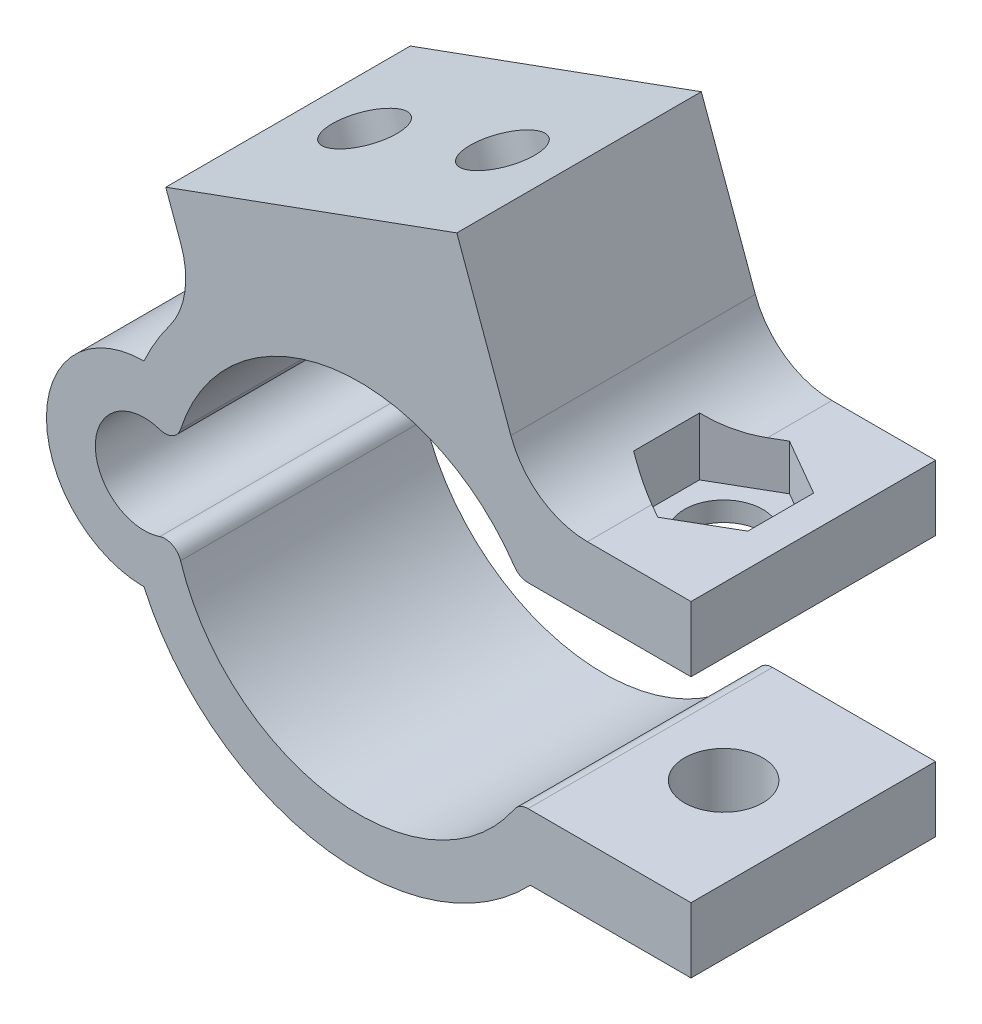
from build123d import *

# Parameters (mm, degrees)
BOSS_EXTRU_1_DEPTH           = 15
ENL_V_MAT_EXTRU_1_DEPTH      = 3
ENL_V_MAT_EXTRU_1_DEPTH_BACK = 2.8
D_GAGEMENT_M42_D             = 4.8
ENL_V_MAT_EXTRU_2_REACH      = 46.643
ESQUISSE11_W                 = 17.14444817
ESQUISSE11_H                 = 8.906875476
ESQUISSE11_R                 = 2.1
BOSS_EXTRU_2_DEPTH           = 3


# Read off the part's stored shape, not the designer's step: Boss.-Extru.1
with BuildPart() as part:
    # Boss.-Extru.1 outline → Boss.-Extru.1 (new body)
    with BuildSketch(Plane.XY):
        with BuildLine():
            Line((5.987288652, 22.39857253), (-11.866871143, 15.900189807))
            Line((-11.866871143, 15.900189807), (-10.941224384, 13.356996238))
            ThreePointArc((-10.941224384, 13.356996238), (-10.69253266, 10.921872002), (-11.629511209, 8.660512054))
            ThreePointArc((-11.629511209, 8.660512054), (-12.486015657, 7.372205437), (-13.200388341, 5.99997897))
            ThreePointArc((-13.200388341, 5.99997897), (-19.184502611, 0), (-13.200388341, -5.99997897))
            ThreePointArc((-13.200388341, -5.99997897), (-2.413103056, -14.297794713), (10.5, -10))
            Line((10.5, -10), (20.356157589, -10))
            Line((20.356157589, -10), (20.356157589, -6))
            Line((20.356157589, -6), (10.356157589, -6))
            ThreePointArc((10.356157589, -6), (9.887116013, -6.116823913), (9.527664982, -6.44))
            ThreePointArc((9.527664982, -6.44), (-1.63993081, -11.38247016), (-10.958116089, -3.488508533))
            ThreePointArc((-10.958116089, -3.488508533), (-11.458744879, -2.899966328), (-12.229372464, -2.843892826))
            ThreePointArc((-12.229372464, -2.843892826), (-16.184502611, 0), (-12.229372464, 2.843892826))
            ThreePointArc((-12.229372464, 2.843892826), (-11.458744879, 2.899966328), (-10.958116089, 3.488508533))
            ThreePointArc((-10.958116089, 3.488508533), (-1.63993081, 11.38247016), (9.527664982, 6.44))
            ThreePointArc((9.527664982, 6.44), (9.887116013, 6.116823913), (10.356157589, 6))
            Line((10.356157589, 6), (20.356157589, 6))
            Line((20.356157589, 6), (20.356157589, 10))
            Line((20.356157589, 10), (14.001037691, 10))
            ThreePointArc((14.001037691, 10), (11.133155509, 10.904239779), (9.302574587, 13.289899283))
            Line((9.302574587, 13.289899283), (5.987288652, 22.39857253))
        make_face()
    extrude(amount=BOSS_EXTRU_1_DEPTH)

    # Esquisse5 → Enlèv. mat.-Extru.1 (cut, two sides: drawn at the far end of the back side and taken through both)
    with BuildSketch(Plane(origin=(0, 10, 0), x_dir=(1, 0, 0), z_dir=(0, 1, 0)).offset(-ENL_V_MAT_EXTRU_1_DEPTH_BACK)):
        Polygon((18.356157589, -9.520725942), (18.356157589, -5.479274058), (14.856157589, -3.458548116), (11.356157589, -5.479274058), (11.356157589, -9.520725942), (14.856157589, -11.541451884), align=None)
    extrude(amount=ENL_V_MAT_EXTRU_1_DEPTH + ENL_V_MAT_EXTRU_1_DEPTH_BACK, mode=Mode.SUBTRACT)

    # Dégagement M42 (through all)
    with Locations(Plane(origin=(0, 10, 0), x_dir=(1, 0, 0), z_dir=(0, 1, 0))):
        with Locations((14.856157589, -7.5)):
            Hole(D_GAGEMENT_M42_D / 2)

    # Esquisse10 → Enlèv. mat.-Extru.2 (cut, up to next)
    with BuildSketch(Plane(origin=(-6.498382723, 17.854159795, 0), x_dir=(0.9396926207859082, 0.3420201433256695, 0), z_dir=(-0.3420201433256695, 0.9396926207859082, 0)), mode=Mode.PRIVATE) as enl_v_mat_extru_2_sk1:
        Polygon((-4.213026048, -9.520725942), (-0.713026048, -11.541451884), (2.786973952, -9.520725942), (2.786973952, -5.479274058), (-0.713026048, -3.458548116), (-4.213026048, -5.479274058), align=None)
    enl_v_mat_extru_2_tool1 = extrude(enl_v_mat_extru_2_sk1.sketch, amount=-ENL_V_MAT_EXTRU_2_REACH, mode=Mode.PRIVATE) & part.part
    # Esquisse10 → Enlèv. mat.-Extru.2 (cut, up to next)
    with BuildSketch(Plane(origin=(-6.498382723, 17.854159795, 0), x_dir=(0.9396926207859082, 0.3420201433256695, 0), z_dir=(-0.3420201433256695, 0.9396926207859082, 0)), mode=Mode.PRIVATE) as enl_v_mat_extru_2_sk2:
        Polygon((11.832491793, -9.439751676), (11.739607101, -5.399367318), (8.194089259, -3.459615641), (4.74145611, -5.560248324), (4.834340802, -9.600632682), (8.379858644, -11.540384359), align=None)
    enl_v_mat_extru_2_tool2 = extrude(enl_v_mat_extru_2_sk2.sketch, amount=-ENL_V_MAT_EXTRU_2_REACH, mode=Mode.PRIVATE) & part.part
    add(enl_v_mat_extru_2_tool1.solids().sort_by_distance((-7.168408, 17.610291, 7.5))[0], mode=Mode.SUBTRACT)
    add(enl_v_mat_extru_2_tool2.solids().sort_by_distance((1.288826, 20.688472, 7.5))[0], mode=Mode.SUBTRACT)

    # Esquisse11 → Boss.-Extru.2 (add)
    with BuildSketch(Plane(origin=(-6.498382723, 17.854159795, 0), x_dir=(0.9396926207859082, 0.3420201433256694, 0), z_dir=(-0.3420201433256694, 0.9396926207859083, 0))):
        with Locations((3.831914323, -7.577227244)):
            Rectangle(ESQUISSE11_W, ESQUISSE11_H)
        with Locations(Location((-0.713026048, -7.5, 0), (0, 0, 180))):
            Circle(ESQUISSE11_R, mode=Mode.SUBTRACT)
        with Locations(Location((8.283576678, -7.5, 0), (0, 0, 180))):
            Circle(ESQUISSE11_R, mode=Mode.SUBTRACT)
    extrude(amount=-BOSS_EXTRU_2_DEPTH)


solid = part.part
